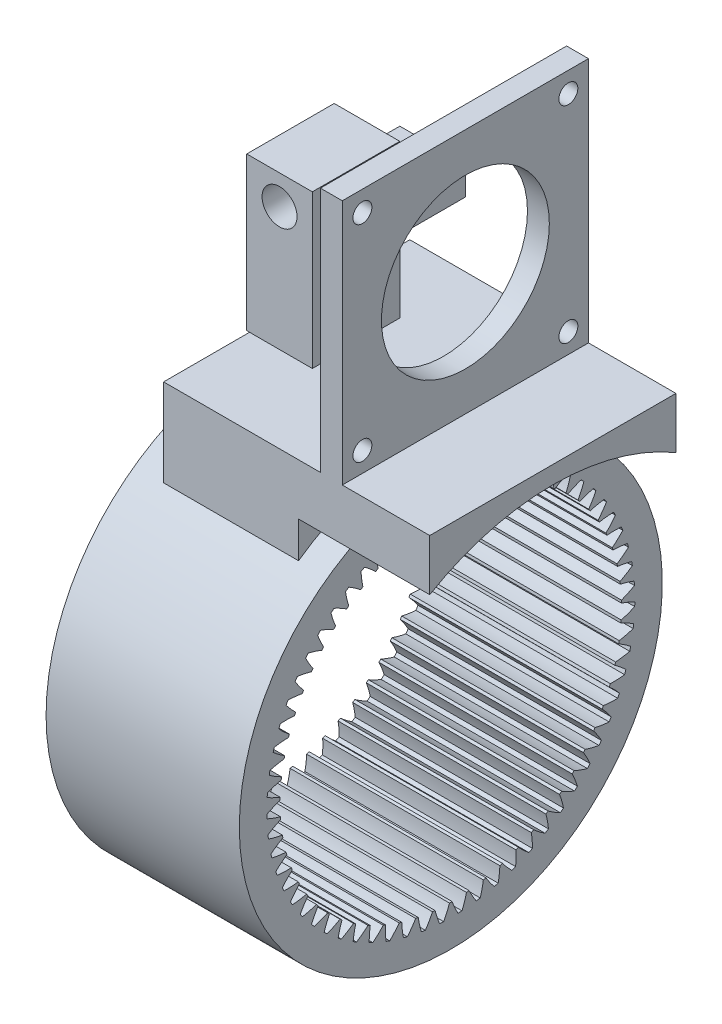
from build123d import *

# Parameters (mm, degrees)
BASPROSKE_W         = 32.815
BASPROSKE_H         = 2.2764
TOOTHCUT_DEPTH      = 56.074954552
TEETHCUTS_COUNT     = 63
SCALE1_SCALE        = 2
SKETCH2_R           = 72.5528
SKETCH2_R_2         = 62.5528
BOSS_EXTRUDE1_DEPTH = 65.63
SCALE2_SCALE        = 1.1
SCALE3_SCALE        = 1.01
SCALE4_SCALE        = 0.99009901
SCALE5_SCALE        = 0.909090909
SCALE6_SCALE        = 1.01
SKETCH3_R           = 73.278328
SKETCH3_R_2         = 72.5528
CUT_EXTRUDE1_DEPTH  = 124.017479557
BOSS_EXTRUDE2_START = -46.2863
BOSS_EXTRUDE2_DEPTH = 46.2863
SCALE7_SCALE        = 0.666666667
BOSS_EXTRUDE3_DEPTH = 30
SKETCH18_W          = 56.3
SKETCH18_H          = 56.3
SKETCH18_R          = 2.165
SKETCH18_R_2        = 19.2
BOSS_EXTRUDE4_DEPTH = 5
SKETCH19_W          = 15
SKETCH19_H          = 35
SKETCH19_R          = 4
BOSS_EXTRUDE5_DEPTH = 10
SKETCH20_W          = 15
SKETCH20_H          = 6.542222388
BOSS_EXTRUDE6_DEPTH = 15
SKETCH21_R          = 2.165
CUT_EXTRUDE2_DEPTH  = 23
CUT_EXTRUDE3_DEPTH  = 3


with BuildPart() as part:
    # BasProSke → Base-Revolve (revolve)
    with BuildSketch(Plane(origin=(0, 0, 0), x_dir=(1, 0, 0), z_dir=(0, 1, 0)), mode=Mode.PRIVATE) as base_revolve_sk:
        with Locations((16.4075, 30.1382)):
            Rectangle(BASPROSKE_W, BASPROSKE_H)
    revolve(base_revolve_sk.sketch.rotate(Axis((-10, 0, 0), (1, 0, 0)), 180), axis=Axis((-10, 0, 0), (1, 0, 0)))

    # TooCutSke → ToothCut (cut, through all)
    with BuildSketch(Plane(origin=(0, 0, 0), x_dir=(0, 0, -1), z_dir=(1, 0, 0))):
        with BuildLine():
            ThreePointArc((1.227357706, 28.948593027), (0.830805794, 30.117149174), (0.339543276, 31.24915537))
            ThreePointArc((0.339543276, 31.24915537), (0, 31.251), (-0.339543276, 31.24915537))
            ThreePointArc((-0.339543276, 31.24915537), (-0.830805794, 30.117149174), (-1.227357706, 28.948593027))
            ThreePointArc((-1.227357706, 28.948593027), (0, 28.9746), (1.227357706, 28.948593027))
        make_face()
    toothcut = extrude(amount=TOOTHCUT_DEPTH, mode=Mode.SUBTRACT)

    # TeethCuts: ToothCut ×63 about axis
    teethcuts_axis = Axis((0, 0, 0), (1, 0, 0))
    for i in range(1, TEETHCUTS_COUNT):
        add(toothcut.rotate(teethcuts_axis, i * 360 / TEETHCUTS_COUNT), mode=Mode.SUBTRACT)


with BuildPart() as part_1:
    # Scale1: scaled about (16.4075, 0, 0)
    add(part.part.scale(SCALE1_SCALE).moved(Location((-16.4075, 0, 0))))

    # Sketch2 → Boss-Extrude1 (add)
    with BuildSketch(Plane(origin=(49.2225, 0, 0), x_dir=(0, 0, -1), z_dir=(1, 0, 0))):
        Circle(SKETCH2_R)
        Circle(SKETCH2_R_2, mode=Mode.SUBTRACT)
    extrude(amount=-BOSS_EXTRUDE1_DEPTH)


with BuildPart() as part_2:
    # Scale2: scaled about (16.4075, 0, 0)
    add(part_1.part.scale(SCALE2_SCALE).moved(Location((-1.64075, 0, 0))))


with BuildPart() as part_3:
    # Scale3: scaled about (16.4075, 0, 0)
    add(part_2.part.scale(SCALE3_SCALE).moved(Location((-0.164075, 0, 0))))


with BuildPart() as part_4:
    # Scale4: scaled about (16.4075, 0, 0)
    add(part_3.part.scale(SCALE4_SCALE).moved(Location((0.162450495, 0, 0))))


with BuildPart() as part_5:
    # Scale5: scaled about (16.4075, 0, 0)
    add(part_4.part.scale(SCALE5_SCALE).moved(Location((1.491590909, 0, 0))))


with BuildPart() as part_6:
    # Scale6: scaled about (16.4075, 0, 0)
    add(part_5.part.scale(SCALE6_SCALE).moved(Location((-0.164075, 0, 0))))

    # Sketch3 → Cut-Extrude1 (cut, through all)
    with BuildSketch(Plane.ZY.offset(16.73565)):
        Circle(SKETCH3_R)
        Circle(SKETCH3_R_2, mode=Mode.SUBTRACT)
    extrude(amount=-CUT_EXTRUDE1_DEPTH, mode=Mode.SUBTRACT)

    # Sketch4 → Boss-Extrude2 (add)
    with BuildSketch(Plane(origin=(39.55065, 0, 0), x_dir=(0, 0, -1), z_dir=(1, 0, 0)).offset(BOSS_EXTRUDE2_START)):
        with BuildLine():
            Line((-42.225, 88.999645447), (-42.225, 58.999645447))
            ThreePointArc((-42.225, 58.999645447), (0, 72.5528), (42.225, 58.999645447))
            Line((42.225, 58.999645447), (42.225, 88.999645447))
            Line((42.225, 88.999645447), (-42.225, 88.999645447))
        make_face()
    extrude(amount=BOSS_EXTRUDE2_DEPTH)


with BuildPart() as part_7:
    # Scale7: scaled about (16.4075, 15.874619557, 0)
    add(part_6.part.scale(SCALE7_SCALE).moved(Location((5.469166667, 5.291539852, 0))))

    # Sketch17 → Boss-Extrude3 (add)
    with BuildSketch(Plane(origin=(31.836266667, 0, 0), x_dir=(0, 0, -1), z_dir=(1, 0, 0))):
        with BuildLine():
            Line((-28.15, 52.896609404), (-28.15, 64.624636817))
            Line((-28.15, 64.624636817), (28.15, 64.624636817))
            Line((28.15, 64.624636817), (28.15, 52.896609404))
            ThreePointArc((28.15, 52.896609404), (0, 60.596739852), (-28.15, 52.896609404))
        make_face()
    extrude(amount=BOSS_EXTRUDE3_DEPTH)

    # Sketch18 → Boss-Extrude4 (add)
    with BuildSketch(Plane(origin=(41.836266667, 0, 0), x_dir=(0, 0, -1), z_dir=(1, 0, 0))):
        with Locations((0, 92.774636817)):
            Rectangle(SKETCH18_W, SKETCH18_H)
        with Locations((-23.55, 116.277331248)):
            Circle(SKETCH18_R, mode=Mode.SUBTRACT)
        with Locations((23.55, 116.277331248)):
            Circle(SKETCH18_R, mode=Mode.SUBTRACT)
        with Locations((-23.55, 69.177331248)):
            Circle(SKETCH18_R, mode=Mode.SUBTRACT)
        with Locations((23.55, 69.177331248)):
            Circle(SKETCH18_R, mode=Mode.SUBTRACT)
        with Locations((0, 92.727331248)):
            Circle(SKETCH18_R_2, mode=Mode.SUBTRACT)
    extrude(amount=-BOSS_EXTRUDE4_DEPTH)

    # Sketch19 → Boss-Extrude5 (add, symmetric)
    with BuildSketch(Plane.XY.offset(-1.5)):
        with Locations((7.836266667, 82.124636817)):
            Rectangle(SKETCH19_W, SKETCH19_H)
        with Locations((7.836266667, 92.918540717)):
            Circle(SKETCH19_R, mode=Mode.SUBTRACT)
    extrude(amount=BOSS_EXTRUDE5_DEPTH, both=True)


with BuildPart() as body_2:
    # Sketch20 → Boss-Extrude6 (new body)
    with BuildSketch(Plane.ZY.offset(-0.336266667)):
        with Locations((-19, 84.353525623)):
            Rectangle(SKETCH20_W, SKETCH20_H)
    extrude(amount=-BOSS_EXTRUDE6_DEPTH)

    # Sketch21 → Cut-Extrude2 (cut)
    with BuildSketch(Plane(origin=(0, 87.624636817, 0), x_dir=(1, 0, 0), z_dir=(0, 1, 0))):
        with Locations(Location((7.836266667, 19, 0), (0, 0, 180))):
            Circle(SKETCH21_R)
    extrude(amount=-CUT_EXTRUDE2_DEPTH, mode=Mode.SUBTRACT)

    # Sketch22 → Cut-Extrude3 (cut)
    with BuildSketch(Plane.XZ.offset(-81.082414429)):
        Polygon((6.261032538, -22.709340305), (10.261032538, -22.218862925), (11.836266667, -18.50952262), (9.411500795, -15.290659695), (5.411500795, -15.781137075), (3.836266667, -19.49047738), align=None)
    extrude(amount=-CUT_EXTRUDE3_DEPTH, mode=Mode.SUBTRACT)


solid = Compound([part_7.part, body_2.part])
